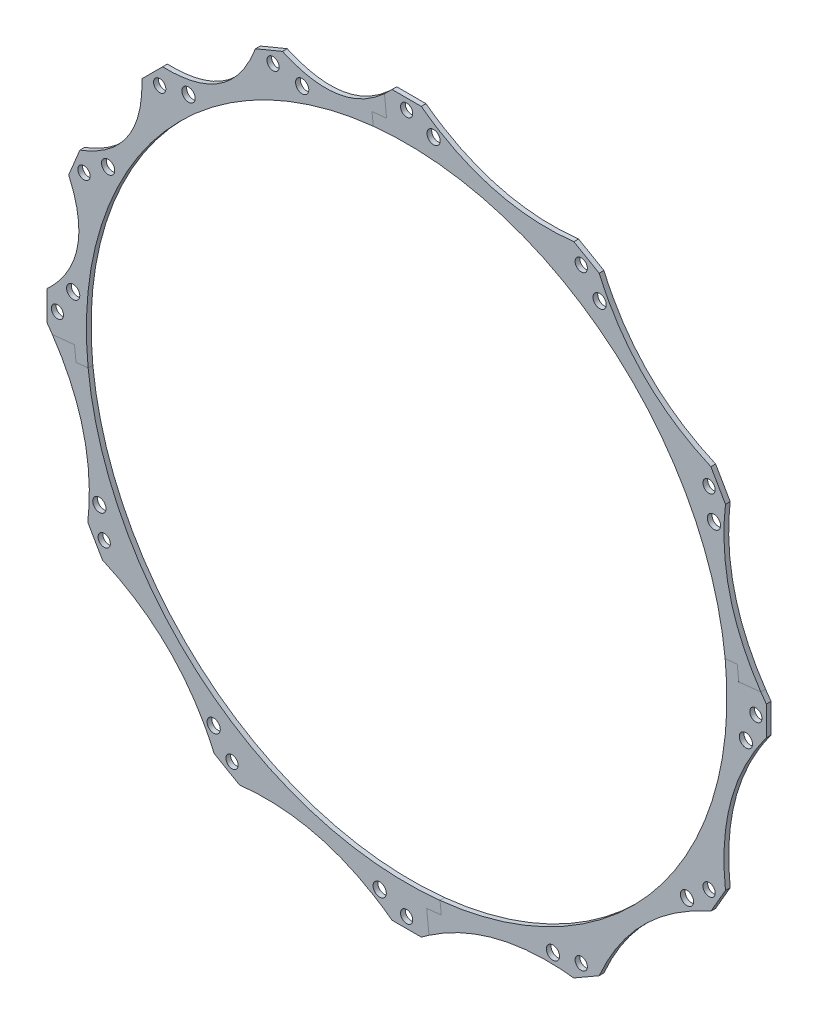
from build123d import *

# Parameters (mm, degrees)
SKETCH4_R            = 169.4688
SKETCH4_R_2          = 3.2385
BOSS_EXTRUDE2_DEPTH  = 2.5
SKETCH8_R            = 3.5
CUT_EXTRUDE2_DEPTH   = 270.197100715
SPLIT1_OUTLINE_R     = 3.5
SPLIT1_OUTLINE_R_2   = 3.2385
SPLIT1_DEPTH         = 2.5
SPLIT1_2_OUTLINE_R   = 3.5
SPLIT1_2_OUTLINE_R_2 = 3.2385
SPLIT1_2_DEPTH       = 2.5
SPLIT1_3_OUTLINE_R   = 3.2385
SPLIT1_3_OUTLINE_R_2 = 3.5
SPLIT1_3_DEPTH       = 2.5
SPLIT1_4_OUTLINE_R   = 3.5
SPLIT1_4_OUTLINE_R_2 = 3.2385
SPLIT1_4_DEPTH       = 2.5


# Read off the part's stored shape, not the designer's step: Split1
with BuildPart() as part:
    # Sketch4 → Boss-Extrude2 (new body)
    with BuildSketch(Plane.XY):
        with BuildLine():
            Line((-7.735342369, 190.342886598), (7.735342369, 190.342886598))
            add(Edge.make_bspline(
                [(7.735342369, 190.342886598), (43.849986057, 163.650375876), (88.472440301, 168.709446408)],
                knots=[0, 0, 0, 1, 1, 1], degree=2))
            Line((88.472440301, 168.709446408), (101.870446297, 160.974104039))
            add(Edge.make_bspline(
                [(101.870446297, 160.974104039), (119.800389819, 119.800389819), (160.974104039, 101.870446297)],
                knots=[0, 0, 0, 1, 1, 1], degree=2))
            Line((160.974104039, 101.870446297), (168.709446408, 88.472440301))
            add(Edge.make_bspline(
                [(168.709446408, 88.472440301), (163.650375876, 43.849986057), (190.342886598, 7.735342369)],
                knots=[0, 0, 0, 1, 1, 1], degree=2))
            Line((190.342886598, 7.735342369), (190.342886598, -7.735342369))
            add(Edge.make_bspline(
                [(190.342886598, -7.735342369), (163.650375876, -43.849986057), (168.709446408, -88.472440301)],
                knots=[0, 0, 0, 1, 1, 1], degree=2))
            Line((168.709446408, -88.472440301), (160.974104039, -101.870446297))
            add(Edge.make_bspline(
                [(160.974104039, -101.870446297), (119.800389819, -119.800389819), (101.870446297, -160.974104039)],
                knots=[0, 0, 0, 1, 1, 1], degree=2))
            Line((101.870446297, -160.974104039), (88.472440301, -168.709446408))
            add(Edge.make_bspline(
                [(88.472440301, -168.709446408), (43.849986057, -163.650375876), (7.735342369, -190.342886598)],
                knots=[0, 0, 0, 1, 1, 1], degree=2))
            Line((7.735342369, -190.342886598), (-7.735342369, -190.342886598))
            add(Edge.make_bspline(
                [(-7.735342369, -190.342886598), (-43.849986057, -163.650375876), (-88.472440301, -168.709446408)],
                knots=[0, 0, 0, 1, 1, 1], degree=2))
            Line((-88.472440301, -168.709446408), (-101.870446297, -160.974104039))
            add(Edge.make_bspline(
                [(-101.870446297, -160.974104039), (-119.800389819, -119.800389819), (-160.974104039, -101.870446297)],
                knots=[0, 0, 0, 1, 1, 1], degree=2))
            Line((-160.974104039, -101.870446297), (-168.709446408, -88.472440301))
            add(Edge.make_bspline(
                [(-168.709446408, -88.472440301), (-163.650375876, -43.849986057), (-190.342886598, -7.735342369)],
                knots=[0, 0, 0, 1, 1, 1], degree=2))
            Line((-190.342886598, -7.735342369), (-190.342886598, 7.735342369))
            add(Edge.make_bspline(
                [(-190.342886598, 7.735342369), (-163.877360858, 32.597233808), (-178.814084455, 65.694544678)],
                knots=[0, 0, 0, 1, 1, 1], degree=2))
            Line((-178.814084455, 65.694544678), (-172.893709719, 79.987593661))
            add(Edge.make_bspline(
                [(-172.893709719, 79.987593661), (-138.92851822, 92.829068072), (-140.062458908, 129.12303282)],
                knots=[0, 0, 0, 1, 1, 1], degree=2))
            Line((-140.062458908, 129.12303282), (-129.12303282, 140.062458908))
            add(Edge.make_bspline(
                [(-129.12303282, 140.062458908), (-92.829068072, 138.92851822), (-79.987593661, 172.893709719)],
                knots=[0, 0, 0, 1, 1, 1], degree=2))
            Line((-79.987593661, 172.893709719), (-65.694544678, 178.814084455))
            add(Edge.make_bspline(
                [(-65.694544678, 178.814084455), (-32.597233808, 163.877360858), (-7.735342369, 190.342886598)],
                knots=[0, 0, 0, 1, 1, 1], degree=2))
        make_face()
        Circle(SKETCH4_R, mode=Mode.SUBTRACT)
        with Locations((0, 184.785)):
            Circle(SKETCH4_R_2, mode=Mode.SUBTRACT)
        with Locations((-160.028504238, -92.3925)):
            Circle(SKETCH4_R_2, mode=Mode.SUBTRACT)
        with Locations((-92.3925, -160.028504238)):
            Circle(SKETCH4_R_2, mode=Mode.SUBTRACT)
        with Locations((0, -184.785)):
            Circle(SKETCH4_R_2, mode=Mode.SUBTRACT)
        with Locations((92.3925, -160.028504238)):
            Circle(SKETCH4_R_2, mode=Mode.SUBTRACT)
        with Locations((160.028504238, -92.3925)):
            Circle(SKETCH4_R_2, mode=Mode.SUBTRACT)
        with Locations((184.785, 0)):
            Circle(SKETCH4_R_2, mode=Mode.SUBTRACT)
        with Locations((160.028504238, 92.3925)):
            Circle(SKETCH4_R_2, mode=Mode.SUBTRACT)
        with Locations((92.3925, 160.028504238)):
            Circle(SKETCH4_R_2, mode=Mode.SUBTRACT)
        with Locations((-70.71415805, 170.719079415)):
            Circle(SKETCH4_R_2, mode=Mode.SUBTRACT)
        with Locations((-130.662726562, 130.662726562)):
            Circle(SKETCH4_R_2, mode=Mode.SUBTRACT)
        with Locations((-170.719079415, 70.71415805)):
            Circle(SKETCH4_R_2, mode=Mode.SUBTRACT)
        with Locations((-184.785, 0)):
            Circle(SKETCH4_R_2, mode=Mode.SUBTRACT)
    extrude(amount=BOSS_EXTRUDE2_DEPTH)

    # Sketch8 → Cut-Extrude2 (cut, through all)
    with BuildSketch(Plane.XY.offset(2.5)):
        with Locations((14.2615, 179.5235)):
            Circle(SKETCH8_R)
        with Locations((-176.455298363, 13.2615)):
            Circle(SKETCH8_R)
        with Locations((102.112571296, 148.341161576)):
            Circle(SKETCH8_R)
        with Locations((162.602661576, 77.410928704)):
            Circle(SKETCH8_R)
        with Locations((179.5235, -14.2615)):
            Circle(SKETCH8_R)
        with Locations((148.341161576, -102.112571296)):
            Circle(SKETCH8_R)
        with Locations((77.410928704, -162.602661576)):
            Circle(SKETCH8_R)
        with Locations((-14.2615, -179.5235)):
            Circle(SKETCH8_R)
        with Locations((-102.112571296, -148.341161576)):
            Circle(SKETCH8_R)
        with Locations((-162.602661576, -77.410928704)):
            Circle(SKETCH8_R)
        with Locations((-157.948482222, 79.778547657)):
            Circle(SKETCH8_R)
        with Locations((-115.39544147, 134.150034627)):
            Circle(SKETCH8_R)
        with Locations((-55.274490816, 168.098394899)):
            Circle(SKETCH8_R)
    extrude(amount=-CUT_EXTRUDE2_DEPTH, mode=Mode.SUBTRACT)

    # Split1 2 outline → Split1 2 (cut)
    with BuildSketch(Plane.XY):
        with BuildLine():
            Line((-174.930314459, -18.327289217), (-175.73872624, -10.611160262))
            Line((-175.73872624, -10.611160262), (-187.432833101, -11.836341153))
            add(Edge.make_bspline(
                [(-187.432833101, -11.836341153), (-163.935721553, -46.366816835), (-168.709446408, -88.472440301)],
                knots=[0.056402787, 0.056402787, 0.056402787, 1, 1, 1], degree=2))
            Line((-168.709446408, -88.472440301), (-160.974104039, -101.870446297))
            add(Edge.make_bspline(
                [(-160.974104039, -101.870446297), (-119.800389819, -119.800389819), (-101.870446297, -160.974104039)],
                knots=[0, 0, 0, 1, 1, 1], degree=2))
            Line((-101.870446297, -160.974104039), (-88.472440301, -168.709446408))
            add(Edge.make_bspline(
                [(-88.472440301, -168.709446408), (-43.849986057, -163.650375876), (-7.735342369, -190.342886598)],
                knots=[0, 0, 0, 1, 1, 1], degree=2))
            Line((-7.735342369, -190.342886598), (7.735342369, -190.342886598))
            add(Edge.make_bspline(
                [(7.735342369, -190.342886598), (43.849986057, -163.650375876), (88.472440301, -168.709446408)],
                knots=[0, 0, 0, 1, 1, 1], degree=2))
            Line((88.472440301, -168.709446408), (101.870446297, -160.974104039))
            add(Edge.make_bspline(
                [(101.870446297, -160.974104039), (119.800389819, -119.800389819), (160.974104039, -101.870446297)],
                knots=[0, 0, 0, 1, 1, 1], degree=2))
            Line((160.974104039, -101.870446297), (168.709446408, -88.472440301))
            add(Edge.make_bspline(
                [(168.709446408, -88.472440301), (163.650375876, -43.849986057), (190.342886598, -7.735342369)],
                knots=[0, 0, 0, 1, 1, 1], degree=2))
            Line((190.342886598, -7.735342369), (190.342886598, 7.735342369))
            add(Edge.make_bspline(
                [(190.342886598, 7.735342369), (163.650375876, 43.849986057), (168.709446408, 88.472440301)],
                knots=[0, 0, 0, 1, 1, 1], degree=2))
            Line((168.709446408, 88.472440301), (160.974104039, 101.870446297))
            add(Edge.make_bspline(
                [(160.974104039, 101.870446297), (119.800389819, 119.800389819), (101.870446297, 160.974104039)],
                knots=[0, 0, 0, 1, 1, 1], degree=2))
            Line((101.870446297, 160.974104039), (88.472440301, 168.709446408))
            add(Edge.make_bspline(
                [(88.472440301, 168.709446408), (43.849986057, 163.650375876), (7.735342369, 190.342886598)],
                knots=[0, 0, 0, 1, 1, 1], degree=2))
            Line((7.735342369, 190.342886598), (-7.735342369, 190.342886598))
            add(Edge.make_bspline(
                [(-7.735342369, 190.342886598), (-9.706229468, 188.244873928), (-11.728870205, 186.407044366)],
                knots=[0, 0, 0, 0.079273417, 0.079273417, 0.079273417], degree=2))
            Line((-11.728870205, 186.407044366), (-10.611160262, 175.73872624))
            Line((-10.611160262, 175.73872624), (-18.327289217, 174.930314459))
            Line((-18.327289217, 174.930314459), (-17.658441351, 168.546295191))
            ThreePointArc((-17.658441351, 168.546295191), (131.666631898, -106.693824649), (-168.546295191, -17.658441351))
            Line((-168.546295191, -17.658441351), (-174.930314459, -18.327289217))
        make_face()
        with Locations((-102.112571296, -148.341161576)):
            Circle(SPLIT1_2_OUTLINE_R, mode=Mode.SUBTRACT)
        with Locations((-92.3925, -160.028504238)):
            Circle(SPLIT1_2_OUTLINE_R_2, mode=Mode.SUBTRACT)
        with Locations((-14.2615, -179.5235)):
            Circle(SPLIT1_2_OUTLINE_R, mode=Mode.SUBTRACT)
        with Locations((0, -184.785)):
            Circle(SPLIT1_2_OUTLINE_R_2, mode=Mode.SUBTRACT)
        with Locations((-160.028504238, -92.3925)):
            Circle(SPLIT1_2_OUTLINE_R_2, mode=Mode.SUBTRACT)
        with Locations((-162.602661576, -77.410928704)):
            Circle(SPLIT1_2_OUTLINE_R, mode=Mode.SUBTRACT)
        with Locations((77.410928704, -162.602661576)):
            Circle(SPLIT1_2_OUTLINE_R, mode=Mode.SUBTRACT)
        with Locations((92.3925, -160.028504238)):
            Circle(SPLIT1_2_OUTLINE_R_2, mode=Mode.SUBTRACT)
        with Locations((148.341161576, -102.112571296)):
            Circle(SPLIT1_2_OUTLINE_R, mode=Mode.SUBTRACT)
        with Locations((160.028504238, -92.3925)):
            Circle(SPLIT1_2_OUTLINE_R_2, mode=Mode.SUBTRACT)
        with Locations((179.5235, -14.2615)):
            Circle(SPLIT1_2_OUTLINE_R, mode=Mode.SUBTRACT)
        with Locations((184.785, 0)):
            Circle(SPLIT1_2_OUTLINE_R_2, mode=Mode.SUBTRACT)
        with Locations((0, 184.785)):
            Circle(SPLIT1_2_OUTLINE_R_2, mode=Mode.SUBTRACT)
        with Locations((162.602661576, 77.410928704)):
            Circle(SPLIT1_2_OUTLINE_R, mode=Mode.SUBTRACT)
        with Locations((160.028504238, 92.3925)):
            Circle(SPLIT1_2_OUTLINE_R_2, mode=Mode.SUBTRACT)
        with Locations((14.2615, 179.5235)):
            Circle(SPLIT1_2_OUTLINE_R, mode=Mode.SUBTRACT)
        with Locations((92.3925, 160.028504238)):
            Circle(SPLIT1_2_OUTLINE_R_2, mode=Mode.SUBTRACT)
        with Locations((102.112571296, 148.341161576)):
            Circle(SPLIT1_2_OUTLINE_R, mode=Mode.SUBTRACT)
    extrude(amount=SPLIT1_2_DEPTH, mode=Mode.SUBTRACT)


with BuildPart() as body_2:
    # Split1 outline → Split1 (new body)
    with BuildSketch(Plane.XY):
        with BuildLine():
            Line((187.432833101, 11.836341153), (175.73872624, 10.611160262))
            Line((175.73872624, 10.611160262), (174.930314459, 18.327289217))
            Line((174.930314459, 18.327289217), (168.546295191, 17.658441351))
            ThreePointArc((168.546295191, 17.658441351), (131.666631898, -106.693824649), (17.658441351, -168.546295191))
            Line((17.658441351, -168.546295191), (18.327289217, -174.930314459))
            Line((18.327289217, -174.930314459), (10.611160262, -175.73872624))
            Line((10.611160262, -175.73872624), (11.836341153, -187.432833101))
            add(Edge.make_bspline(
                [(11.836341153, -187.432833101), (46.366816835, -163.935721553), (88.472440301, -168.709446408)],
                knots=[0.056402787, 0.056402787, 0.056402787, 1, 1, 1], degree=2))
            Line((88.472440301, -168.709446408), (101.870446297, -160.974104039))
            add(Edge.make_bspline(
                [(101.870446297, -160.974104039), (119.800389819, -119.800389819), (160.974104039, -101.870446297)],
                knots=[0, 0, 0, 1, 1, 1], degree=2))
            Line((160.974104039, -101.870446297), (168.709446408, -88.472440301))
            add(Edge.make_bspline(
                [(168.709446408, -88.472440301), (163.650375876, -43.849986057), (190.342886598, -7.735342369)],
                knots=[0, 0, 0, 1, 1, 1], degree=2))
            Line((190.342886598, -7.735342369), (190.342886598, 7.735342369))
            add(Edge.make_bspline(
                [(190.342886598, 7.735342369), (188.837354604, 9.772308921), (187.432833101, 11.836341153)],
                knots=[0, 0, 0, 0.056402787, 0.056402787, 0.056402787], degree=2))
        make_face()
        with Locations((77.410928704, -162.602661576)):
            Circle(SPLIT1_OUTLINE_R, mode=Mode.SUBTRACT)
        with Locations((92.3925, -160.028504238)):
            Circle(SPLIT1_OUTLINE_R_2, mode=Mode.SUBTRACT)
        with Locations((148.341161576, -102.112571296)):
            Circle(SPLIT1_OUTLINE_R, mode=Mode.SUBTRACT)
        with Locations((160.028504238, -92.3925)):
            Circle(SPLIT1_OUTLINE_R_2, mode=Mode.SUBTRACT)
        with Locations((179.5235, -14.2615)):
            Circle(SPLIT1_OUTLINE_R, mode=Mode.SUBTRACT)
        with Locations((184.785, 0)):
            Circle(SPLIT1_OUTLINE_R_2, mode=Mode.SUBTRACT)
    extrude(amount=SPLIT1_DEPTH)


with BuildPart() as body_3:
    # Split1 3 outline → Split1 3 (new body)
    with BuildSketch(Plane.XY):
        with BuildLine():
            Line((11.836341153, -187.432833101), (10.611160262, -175.73872624))
            Line((10.611160262, -175.73872624), (18.327289217, -174.930314459))
            Line((18.327289217, -174.930314459), (17.658441351, -168.546295191))
            ThreePointArc((17.658441351, -168.546295191), (-106.693824649, -131.666631898), (-168.546295191, -17.658441351))
            Line((-168.546295191, -17.658441351), (-174.930314459, -18.327289217))
            Line((-174.930314459, -18.327289217), (-175.73872624, -10.611160262))
            Line((-175.73872624, -10.611160262), (-187.432833101, -11.836341153))
            add(Edge.make_bspline(
                [(-187.432833101, -11.836341153), (-163.935721553, -46.366816835), (-168.709446408, -88.472440301)],
                knots=[0.056402787, 0.056402787, 0.056402787, 1, 1, 1], degree=2))
            Line((-168.709446408, -88.472440301), (-160.974104039, -101.870446297))
            add(Edge.make_bspline(
                [(-160.974104039, -101.870446297), (-119.800389819, -119.800389819), (-101.870446297, -160.974104039)],
                knots=[0, 0, 0, 1, 1, 1], degree=2))
            Line((-101.870446297, -160.974104039), (-88.472440301, -168.709446408))
            add(Edge.make_bspline(
                [(-88.472440301, -168.709446408), (-43.849986057, -163.650375876), (-7.735342369, -190.342886598)],
                knots=[0, 0, 0, 1, 1, 1], degree=2))
            Line((-7.735342369, -190.342886598), (7.735342369, -190.342886598))
            add(Edge.make_bspline(
                [(7.735342369, -190.342886598), (9.772308921, -188.837354604), (11.836341153, -187.432833101)],
                knots=[0, 0, 0, 0.056402787, 0.056402787, 0.056402787], degree=2))
        make_face()
        with Locations((-92.3925, -160.028504238)):
            Circle(SPLIT1_3_OUTLINE_R, mode=Mode.SUBTRACT)
        with Locations((-102.112571296, -148.341161576)):
            Circle(SPLIT1_3_OUTLINE_R_2, mode=Mode.SUBTRACT)
        with Locations((-14.2615, -179.5235)):
            Circle(SPLIT1_3_OUTLINE_R_2, mode=Mode.SUBTRACT)
        with Locations((0, -184.785)):
            Circle(SPLIT1_3_OUTLINE_R, mode=Mode.SUBTRACT)
        with Locations((-160.028504238, -92.3925)):
            Circle(SPLIT1_3_OUTLINE_R, mode=Mode.SUBTRACT)
        with Locations((-162.602661576, -77.410928704)):
            Circle(SPLIT1_3_OUTLINE_R_2, mode=Mode.SUBTRACT)
    extrude(amount=SPLIT1_3_DEPTH)


with BuildPart() as body_4:
    # Split1 4 outline → Split1 4 (new body)
    with BuildSketch(Plane.XY):
        with BuildLine():
            Line((-11.728870205, 186.407044366), (-10.611160262, 175.73872624))
            Line((-10.611160262, 175.73872624), (-18.327289217, 174.930314459))
            Line((-18.327289217, 174.930314459), (-17.658441351, 168.546295191))
            ThreePointArc((-17.658441351, 168.546295191), (106.693824649, 131.666631898), (168.546295191, 17.658441351))
            Line((168.546295191, 17.658441351), (174.930314459, 18.327289217))
            Line((174.930314459, 18.327289217), (175.73872624, 10.611160262))
            Line((175.73872624, 10.611160262), (187.432833101, 11.836341153))
            add(Edge.make_bspline(
                [(187.432833101, 11.836341153), (163.935721553, 46.366816835), (168.709446408, 88.472440301)],
                knots=[0.056402787, 0.056402787, 0.056402787, 1, 1, 1], degree=2))
            Line((168.709446408, 88.472440301), (160.974104039, 101.870446297))
            add(Edge.make_bspline(
                [(160.974104039, 101.870446297), (119.800389819, 119.800389819), (101.870446297, 160.974104039)],
                knots=[0, 0, 0, 1, 1, 1], degree=2))
            Line((101.870446297, 160.974104039), (88.472440301, 168.709446408))
            add(Edge.make_bspline(
                [(88.472440301, 168.709446408), (43.849986057, 163.650375876), (7.735342369, 190.342886598)],
                knots=[0, 0, 0, 1, 1, 1], degree=2))
            Line((7.735342369, 190.342886598), (-7.735342369, 190.342886598))
            add(Edge.make_bspline(
                [(-7.735342369, 190.342886598), (-9.706229468, 188.244873928), (-11.728870205, 186.407044366)],
                knots=[0, 0, 0, 0.079273417, 0.079273417, 0.079273417], degree=2))
        make_face()
        with Locations((162.602661576, 77.410928704)):
            Circle(SPLIT1_4_OUTLINE_R, mode=Mode.SUBTRACT)
        with Locations((160.028504238, 92.3925)):
            Circle(SPLIT1_4_OUTLINE_R_2, mode=Mode.SUBTRACT)
        with Locations((0, 184.785)):
            Circle(SPLIT1_4_OUTLINE_R_2, mode=Mode.SUBTRACT)
        with Locations((14.2615, 179.5235)):
            Circle(SPLIT1_4_OUTLINE_R, mode=Mode.SUBTRACT)
        with Locations((102.112571296, 148.341161576)):
            Circle(SPLIT1_4_OUTLINE_R, mode=Mode.SUBTRACT)
        with Locations((92.3925, 160.028504238)):
            Circle(SPLIT1_4_OUTLINE_R_2, mode=Mode.SUBTRACT)
    extrude(amount=SPLIT1_4_DEPTH)


solid = Compound([part.part, body_2.part, body_3.part, body_4.part])
